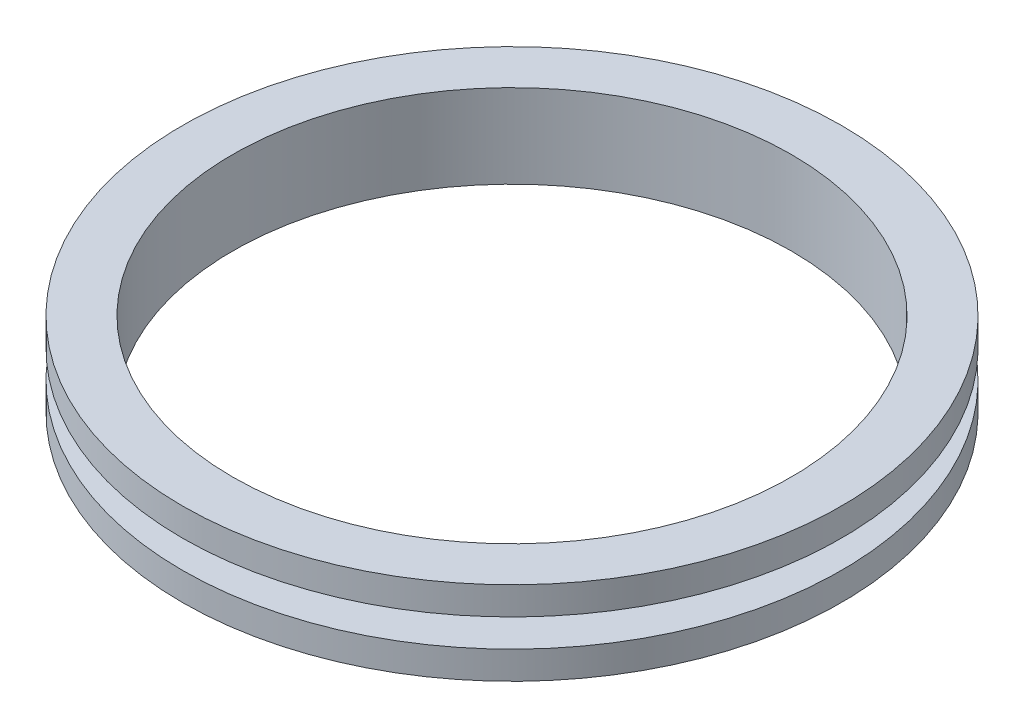
from build123d import *

# Parameters (mm, degrees)
SKETCH1_R           = 25.019
BOSS_EXTRUDE1_DEPTH = 2.116666667
SKETCH2_R           = 21.59
BOSS_EXTRUDE2_DEPTH = 2.116666667
SKETCH3_R           = 25.019
BOSS_EXTRUDE3_DEPTH = 2.116666667
SKETCH5_R           = 21.209
CUT_EXTRUDE1_DEPTH  = 36.947506478


with BuildPart() as part:
    # Sketch1 → Boss-Extrude1 (new body)
    with BuildSketch(Plane(origin=(0, 0, 0), x_dir=(1, 0, 0), z_dir=(0, 1, 0))):
        Circle(SKETCH1_R)
    extrude(amount=BOSS_EXTRUDE1_DEPTH)

    # Sketch2 → Boss-Extrude2 (add)
    with BuildSketch(Plane(origin=(0, 2.116666667, 0), x_dir=(1, 0, 0), z_dir=(0, 1, 0))):
        Circle(SKETCH2_R)
    extrude(amount=BOSS_EXTRUDE2_DEPTH)

    # Sketch3 → Boss-Extrude3 (add)
    with BuildSketch(Plane(origin=(0, 4.233333333, 0), x_dir=(1, 0, 0), z_dir=(0, 1, 0))):
        Circle(SKETCH3_R)
    extrude(amount=BOSS_EXTRUDE3_DEPTH)

    # Sketch5 → Cut-Extrude1 (cut, through all)
    with BuildSketch(Plane(origin=(0, 6.35, 0), x_dir=(1, 0, 0), z_dir=(0, 1, 0))):
        Circle(SKETCH5_R)
    extrude(amount=-CUT_EXTRUDE1_DEPTH, mode=Mode.SUBTRACT)


solid = part.part
